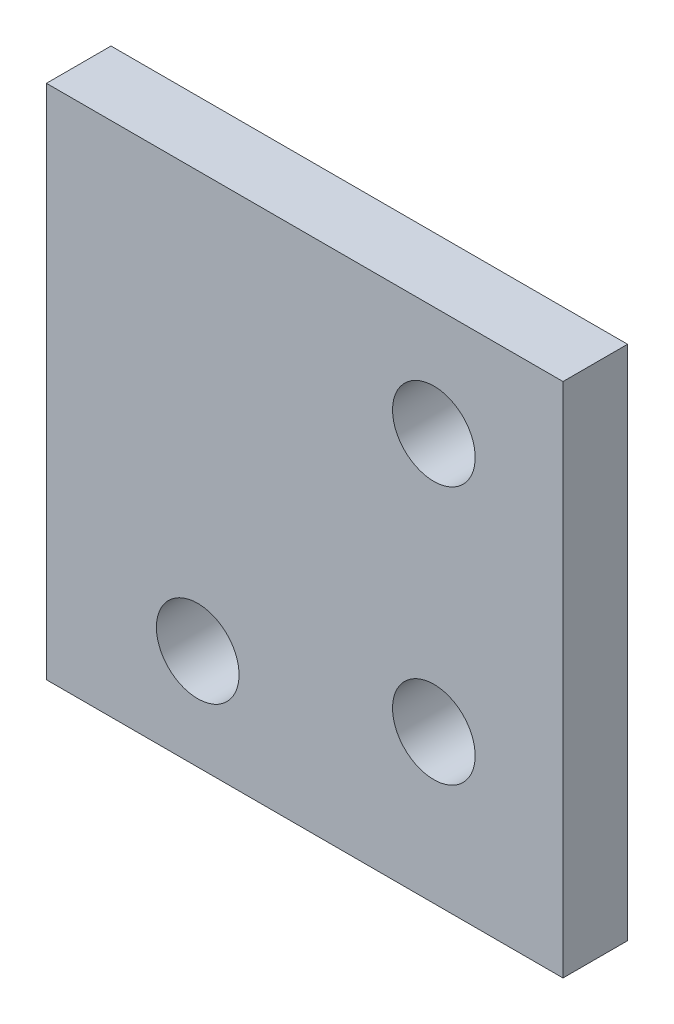
from build123d import *

# Parameters (mm, degrees)
SKETCH1_W               = 25.4
SKETCH1_H               = 25.4
BOSS_EXTRUDE1_DEPTH     = 3.175
CUT_EXTRUDE1_DEPTH      = 19.238986403
CUT_EXTRUDE1_DEPTH_BACK = 19.238986403
SKETCH2_R               = 2.032


with BuildPart() as part:
    # Sketch1 → Boss-Extrude1 (new body)
    with BuildSketch(Plane.XY):
        Rectangle(SKETCH1_W, SKETCH1_H)
    extrude(amount=BOSS_EXTRUDE1_DEPTH)

    # Sketch2 → Cut-Extrude1 (cut, two sides: drawn at the far end of the back side and taken through both)
    with BuildSketch(Plane(origin=(0, 0, 0), x_dir=(-1, 0, 0), z_dir=(0, 0, -1)).offset(-CUT_EXTRUDE1_DEPTH_BACK)):
        with Locations((5.260501756, -7.756353865)):
            Circle(SKETCH2_R)
        with Locations((-6.350010486, -5.396866107)):
            Circle(SKETCH2_R)
        with Locations((-6.350010486, 7.303133893)):
            Circle(SKETCH2_R)
    extrude(amount=CUT_EXTRUDE1_DEPTH + CUT_EXTRUDE1_DEPTH_BACK, mode=Mode.SUBTRACT)


solid = part.part
